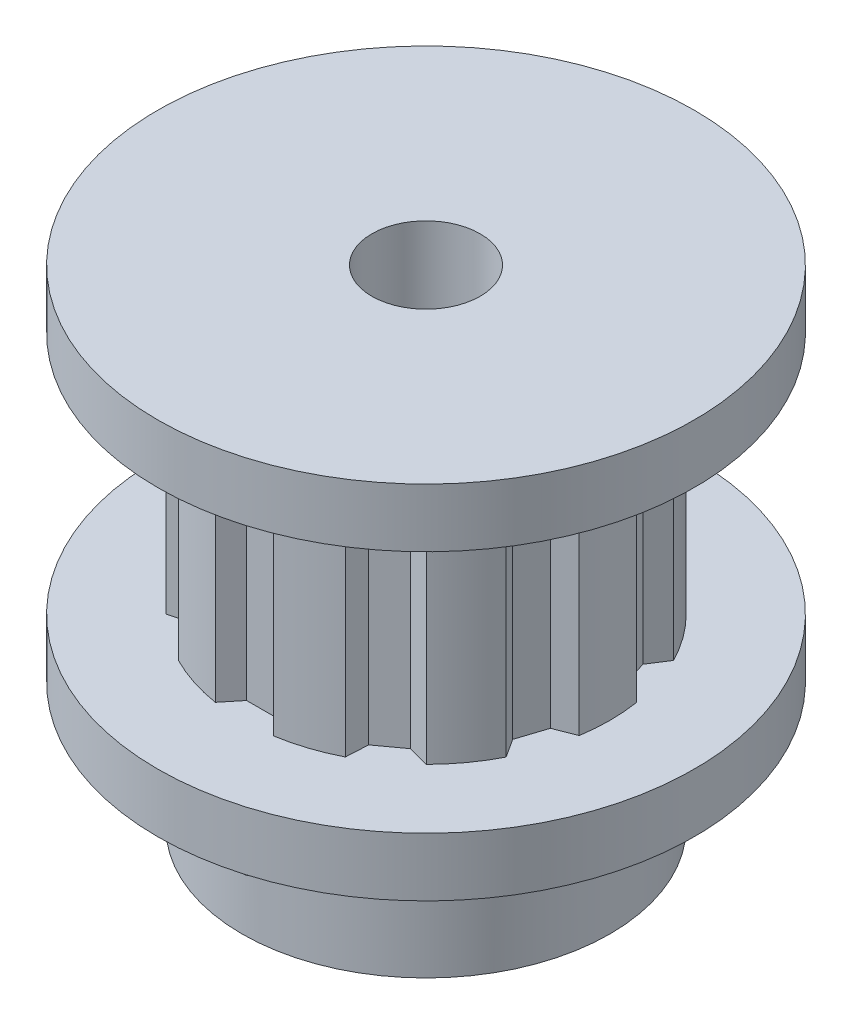
from build123d import *

# Parameters (mm, degrees)
SKETCH1_R               = 11.7983
SKETCH1_R_2             = 2.38125
BOSS_EXTRUDE1_DEPTH     = 15.875
SKETCH4_R               = 21.057189505
SKETCH4_R_2             = 8.0899
CUT_EXTRUDE2_DEPTH      = 5.3594
CUT_EXTRUDE1_DEPTH      = 5.3594
CIRPATTERN1_COUNT       = 10
BOSS_EXTRUDE2_START     = 5.55625
SKETCH6_R               = 8.0899
SKETCH6_R_2             = 2.38125
BOSS_EXTRUDE2_DEPTH     = 5.55625
CUT_EXTRUDE3_DEPTH      = 24.030748811
CUT_EXTRUDE3_DEPTH_BACK = 24.030748811
SKETCH7_R               = 0.8255


with BuildPart() as part:
    # Sketch1 → Boss-Extrude1 (new body)
    with BuildSketch(Plane(origin=(0, 0, 0), x_dir=(1, 0, 0), z_dir=(0, 1, 0))):
        Circle(SKETCH1_R)
        Circle(SKETCH1_R_2, mode=Mode.SUBTRACT)
    extrude(amount=BOSS_EXTRUDE1_DEPTH)

    # Sketch4 → Cut-Extrude2 (cut, symmetric)
    with BuildSketch(Plane(origin=(0, 7.9375, 0), x_dir=(-1, 0, 0), z_dir=(0, 1, 0))):
        Circle(SKETCH4_R)
        Circle(SKETCH4_R_2, mode=Mode.SUBTRACT)
    extrude(amount=CUT_EXTRUDE2_DEPTH, both=True, mode=Mode.SUBTRACT)

    # Sketch3 → Cut-Extrude1 (cut, symmetric)
    with BuildSketch(Plane(origin=(0, 7.9375, 0), x_dir=(-1, 0, 0), z_dir=(0, 1, 0))):
        Polygon((-2.362195181, 9.323389625), (2.362195181, 9.323389625), (0.65839456, 7.231867448), (-0.65839456, 7.231867448), align=None)
    cut_extrude1 = extrude(amount=CUT_EXTRUDE1_DEPTH, both=True, mode=Mode.SUBTRACT)

    # CirPattern1: Cut-Extrude1 ×10 about axis
    cirpattern1_axis = Axis((0, 15.875, 0), (0, 1, 0))
    for i in range(1, CIRPATTERN1_COUNT):
        add(cut_extrude1.rotate(cirpattern1_axis, i * 360 / CIRPATTERN1_COUNT), mode=Mode.SUBTRACT)

    # Sketch6 → Boss-Extrude2 (add)
    with BuildSketch(Plane.XZ.offset(BOSS_EXTRUDE2_START)):
        Circle(SKETCH6_R)
        Circle(SKETCH6_R_2, mode=Mode.SUBTRACT)
    extrude(amount=-BOSS_EXTRUDE2_DEPTH)

    # Sketch7 → Cut-Extrude3 (cut, two sides: drawn at the far end of the back side and taken through both)
    with BuildSketch(Plane.XY.offset(-CUT_EXTRUDE3_DEPTH_BACK)):
        with Locations((0, -2.420099543)):
            Circle(SKETCH7_R)
    extrude(amount=CUT_EXTRUDE3_DEPTH + CUT_EXTRUDE3_DEPTH_BACK, mode=Mode.SUBTRACT)


solid = part.part
